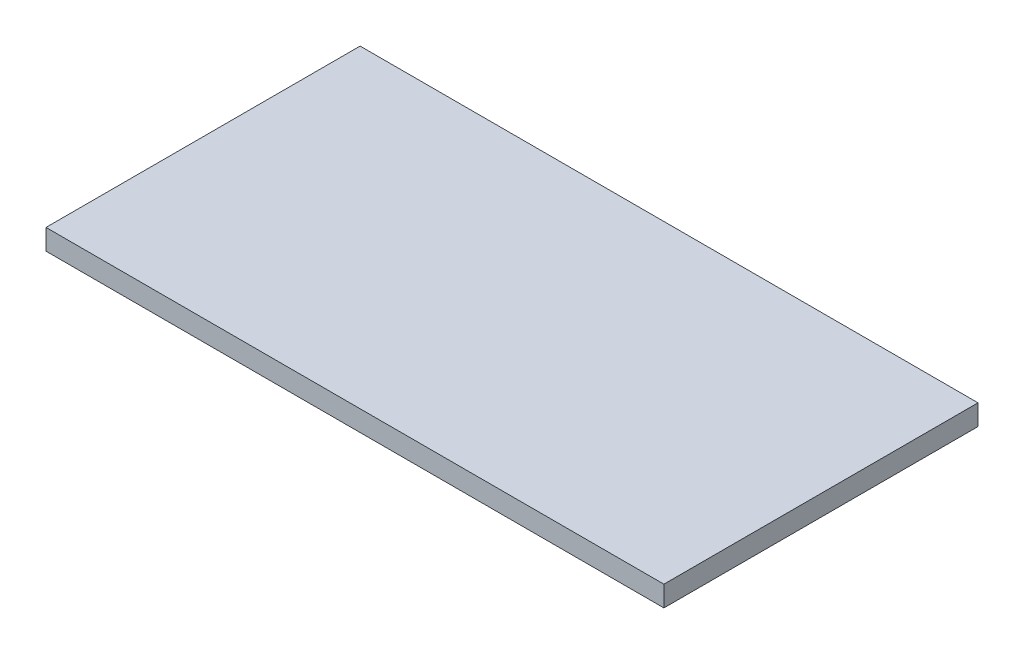
from build123d import *

# Parameters (mm, degrees)
SKETCH1_W           = 120
SKETCH1_H           = 61
BOSS_EXTRUDE1_DEPTH = 4


with BuildPart() as part:
    # Sketch1 → Boss-Extrude1 (new body)
    with BuildSketch(Plane(origin=(0, 0, 0), x_dir=(1, 0, 0), z_dir=(0, 1, 0))):
        with Locations((60, 0)):
            Rectangle(SKETCH1_W, SKETCH1_H)
    extrude(amount=BOSS_EXTRUDE1_DEPTH)


solid = part.part
